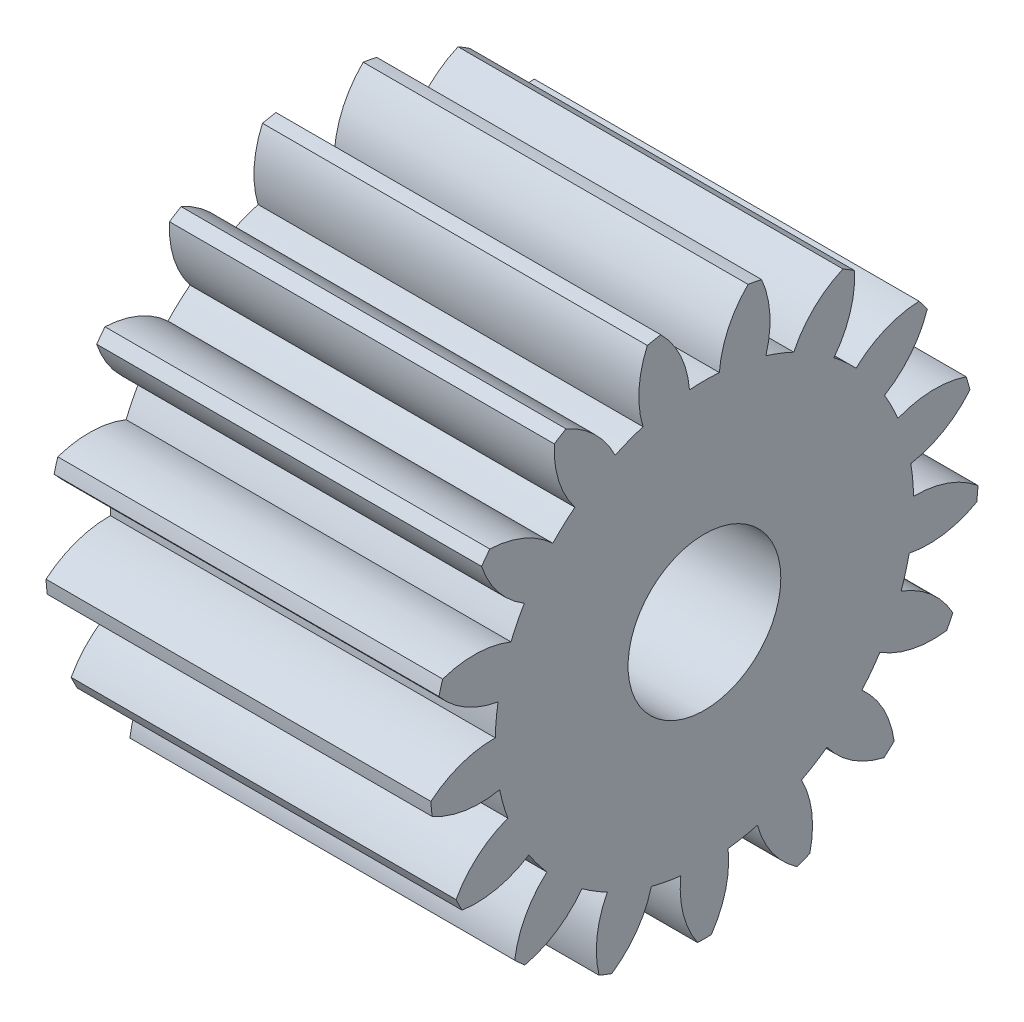
from build123d import *

# Parameters (mm, degrees)
SPUR_START             = -92.950977625
SPUR_GEAR_AM_OUTLINE_R = 1.5
SPUR_GEAR_AM_DEPTH     = 8.001
SKETCH1_R              = 1.5875
CUT_EXTRUDE1_DEPTH     = 50.509189617


# Read off the part's stored shape, not the designer's step: spur gear_am
with BuildPart() as part:
    # spur gear_am outline → spur gear_am (new body)
    with BuildSketch(Plane.YZ.offset(SPUR_START)):
        with BuildLine():
            ThreePointArc((31.652652911, 27.663945588), (31.729301927, 27.784343625), (31.802912423, 27.906623033))
            ThreePointArc((31.802912423, 27.906623033), (31.401254023, 28.50628356), (30.815920965, 28.928548203))
            ThreePointArc((30.815920965, 28.928548203), (30.938385979, 29.213966947), (31.040168606, 29.50739809))
            ThreePointArc((31.040168606, 29.50739809), (31.757212806, 29.425119095), (32.45803063, 29.597678058))
            ThreePointArc((32.45803063, 29.597678058), (32.486010922, 29.737634702), (32.510478248, 29.878248033))
            ThreePointArc((32.510478248, 29.878248033), (31.919320576, 30.292319071), (31.220974171, 30.474622435))
            ThreePointArc((31.220974171, 30.474622435), (31.232064254, 30.785006953), (31.220974171, 31.095391471))
            ThreePointArc((31.220974171, 31.095391471), (31.919320576, 31.277694835), (32.510478248, 31.691765874))
            ThreePointArc((32.510478248, 31.691765874), (32.486010922, 31.832379205), (32.45803063, 31.972335848))
            ThreePointArc((32.45803063, 31.972335848), (31.757212806, 32.144894811), (31.040168606, 32.062615816))
            ThreePointArc((31.040168606, 32.062615816), (30.938385979, 32.356046959), (30.815920965, 32.641465703))
            ThreePointArc((30.815920965, 32.641465703), (31.401254023, 33.063730346), (31.802912423, 33.663390873))
            ThreePointArc((31.802912423, 33.663390873), (31.729301927, 33.785670282), (31.652652911, 33.906068318))
            ThreePointArc((31.652652911, 33.906068318), (30.936824265, 33.81381016), (30.297923062, 33.47806104))
            ThreePointArc((30.297923062, 33.47806104), (30.097014035, 33.714909307), (29.879713667, 33.936814893))
            ThreePointArc((29.879713667, 33.936814893), (30.272980906, 34.542011636), (30.430893842, 35.246274174))
            ThreePointArc((30.430893842, 35.246274174), (30.318081681, 35.333705149), (30.203115814, 35.418284156))
            ThreePointArc((30.203115814, 35.418284156), (29.568952972, 35.073668852), (29.094481914, 34.529794388))
            ThreePointArc((29.094481914, 34.529794388), (28.821580363, 34.678072107), (28.538792261, 34.806494957))
            ThreePointArc((28.538792261, 34.806494957), (28.68688076, 35.512888625), (28.579721215, 36.226638616))
            ThreePointArc((28.579721215, 36.226638616), (28.442943297, 36.267413119), (28.305187358, 36.304750233))
            ThreePointArc((28.305187358, 36.304750233), (27.838337524, 35.754319991), (27.592376558, 35.075773441))
            ThreePointArc((27.592376558, 35.075773441), (27.284339349, 35.115454886), (26.974255613, 35.133050782))
            ThreePointArc((26.974255613, 35.133050782), (26.8571652, 35.845238996), (26.499405664, 36.472080549))
            ThreePointArc((26.499405664, 36.472080549), (26.357134605, 36.460691758), (26.215193296, 36.445744395))
            ThreePointArc((26.215193296, 36.445744395), (25.978707128, 35.763837869), (25.994474644, 35.042260705))
            ThreePointArc((25.994474644, 35.042260705), (25.69290391, 34.967986675), (25.397403066, 34.872379194))
            ThreePointArc((25.397403066, 34.872379194), (25.030947451, 35.494176991), (24.470905332, 35.94945168))
            ThreePointArc((24.470905332, 35.94945168), (24.342355626, 35.887437714), (24.215398907, 35.822224598))
            ThreePointArc((24.215398907, 35.822224598), (24.241215173, 35.100937042), (24.51658168, 34.433782259))
            ThreePointArc((24.51658168, 34.433782259), (24.26220622, 34.255583875), (24.021197296, 34.059685336))
            ThreePointArc((24.021197296, 34.059685336), (23.454868339, 34.507115477), (22.768180428, 34.729335933))
            ThreePointArc((22.768180428, 34.729335933), (22.670713426, 34.625072122), (22.575887506, 34.518400646))
            ThreePointArc((22.575887506, 34.518400646), (22.860519576, 33.855145941), (23.358295302, 33.332516489))
            ThreePointArc((23.358295302, 33.332516489), (23.18546993, 33.074460429), (23.031502516, 32.804728017))
            ThreePointArc((23.031502516, 32.804728017), (22.341786081, 33.017362582), (21.621193386, 32.976516701))
            ThreePointArc((21.621193386, 32.976516701), (21.567972546, 32.84408445), (21.518084191, 32.710361188))
            ThreePointArc((21.518084191, 32.710361188), (22.023090926, 32.194715558), (22.676048502, 31.88719544))
            ThreePointArc((22.676048502, 31.88719544), (22.608114243, 31.584133606), (22.561982491, 31.276996177))
            ThreePointArc((22.561982491, 31.276996177), (21.842028605, 31.22611769), (21.184851162, 30.927721934))
            ThreePointArc((21.184851162, 30.927721934), (21.183064254, 30.785006953), (21.184851162, 30.642291972))
            ThreePointArc((21.184851162, 30.642291972), (21.842028605, 30.343896216), (22.561982491, 30.293017729))
            ThreePointArc((22.561982491, 30.293017729), (22.608114243, 29.9858803), (22.676048502, 29.682818466))
            ThreePointArc((22.676048502, 29.682818466), (22.023090926, 29.375298348), (21.518084191, 28.859652718))
            ThreePointArc((21.518084191, 28.859652718), (21.567972546, 28.725929456), (21.621193386, 28.593497205))
            ThreePointArc((21.621193386, 28.593497205), (22.341786081, 28.552651324), (23.031502516, 28.765285889))
            ThreePointArc((23.031502516, 28.765285889), (23.18546993, 28.495553477), (23.358295302, 28.237497417))
            ThreePointArc((23.358295302, 28.237497417), (22.860519576, 27.714867965), (22.575887506, 27.051613261))
            ThreePointArc((22.575887506, 27.051613261), (22.670713426, 26.944941784), (22.768180428, 26.840677973))
            ThreePointArc((22.768180428, 26.840677973), (23.454868339, 27.062898429), (24.021197296, 27.51032857))
            ThreePointArc((24.021197296, 27.51032857), (24.26220622, 27.314430032), (24.51658168, 27.136231648))
            ThreePointArc((24.51658168, 27.136231648), (24.241215173, 26.469076865), (24.215398907, 25.747789309))
            ThreePointArc((24.215398907, 25.747789309), (24.342355626, 25.682576192), (24.470905332, 25.620562226))
            ThreePointArc((24.470905332, 25.620562226), (25.030947451, 26.075836915), (25.397403066, 26.697634712))
            ThreePointArc((25.397403066, 26.697634712), (25.69290391, 26.602027231), (25.994474644, 26.527753202))
            ThreePointArc((25.994474644, 26.527753202), (25.978707128, 25.806176038), (26.215193296, 25.124269511))
            ThreePointArc((26.215193296, 25.124269511), (26.357134605, 25.109322148), (26.499405664, 25.097933357))
            ThreePointArc((26.499405664, 25.097933357), (26.8571652, 25.72477491), (26.974255613, 26.436963124))
            ThreePointArc((26.974255613, 26.436963124), (27.284339349, 26.45455902), (27.592376558, 26.494240465))
            ThreePointArc((27.592376558, 26.494240465), (27.838337524, 25.815693915), (28.305187358, 25.265263673))
            ThreePointArc((28.305187358, 25.265263673), (28.442943297, 25.302600787), (28.579721215, 25.34337529))
            ThreePointArc((28.579721215, 25.34337529), (28.68688076, 26.057125281), (28.538792261, 26.763518949))
            ThreePointArc((28.538792261, 26.763518949), (28.821580363, 26.891941799), (29.094481914, 27.040219519))
            ThreePointArc((29.094481914, 27.040219519), (29.568952972, 26.496345054), (30.203115814, 26.151729751))
            ThreePointArc((30.203115814, 26.151729751), (30.318081681, 26.236308758), (30.430893842, 26.323739732))
            ThreePointArc((30.430893842, 26.323739732), (30.272980906, 27.02800227), (29.879713667, 27.633199013))
            ThreePointArc((29.879713667, 27.633199013), (30.097014035, 27.855104599), (30.297923062, 28.091952866))
            ThreePointArc((30.297923062, 28.091952866), (30.936824265, 27.756203746), (31.652652911, 27.663945588))
        make_face()
        with Locations((26.883064254, 30.785006953)):
            Circle(SPUR_GEAR_AM_OUTLINE_R, mode=Mode.SUBTRACT)
    extrude(amount=SPUR_GEAR_AM_DEPTH)

    # Sketch1 → Cut-Extrude1 (cut, through all)
    with BuildSketch(Plane(origin=(-84.949977625, 0, 0), x_dir=(0, 0, -1), z_dir=(1, 0, 0))):
        with Locations((-30.785006953, 26.883064254)):
            Circle(SKETCH1_R)
    extrude(amount=-CUT_EXTRUDE1_DEPTH, mode=Mode.SUBTRACT)


solid = part.part
